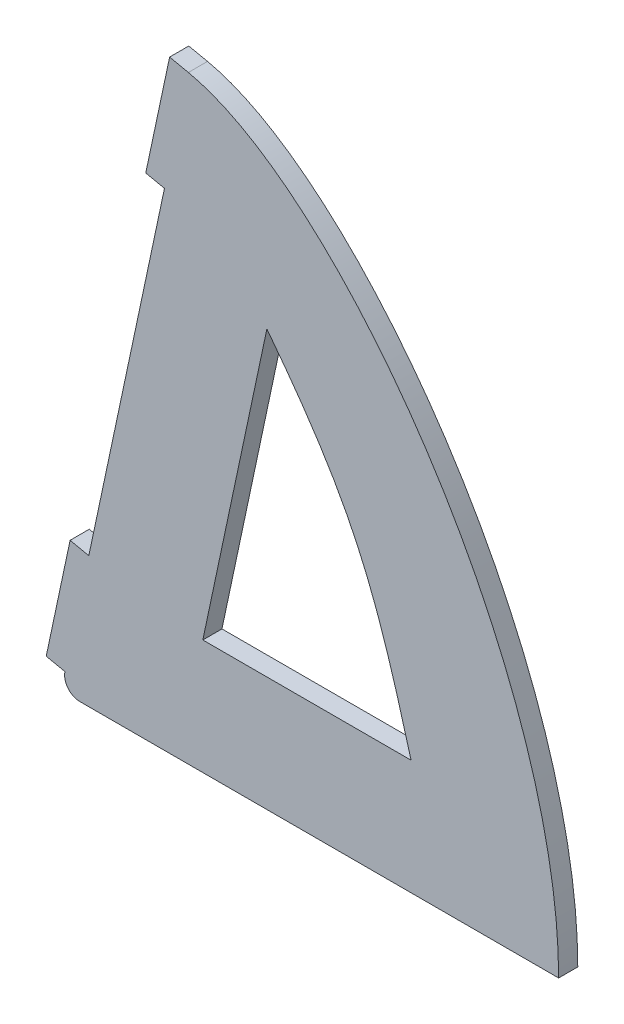
from build123d import *

# Parameters (mm, degrees)
BOSS_EXTRUDE1_DEPTH = 3.175


with BuildPart() as part:
    # Sketch1 → Boss-Extrude1 (new body)
    with BuildSketch(Plane.XY):
        with BuildLine():
            Line((17.163110077, 80.746084441), (4.612861582, 21.701807489))
            Line((4.612861582, 21.701807489), (1.507242949, 22.361927107))
            Line((1.507242949, 22.361927107), (-2.453474761, 3.728215313))
            Line((-2.453474761, 3.728215313), (0.652143872, 3.068095695))
            ThreePointArc((0.652143872, 3.068095695), (1.162688035, 0.941526207), (3.136638778, 0))
            Line((3.136638778, 0), (82.55, 0))
            add(Edge.make_bspline(
                [(21.123827787, 99.379796235), (46.706655255, 93.94199839), (82.55, 42.642349052), (82.55, 0)],
                knots=[0, 0, 0, 0, 1, 1, 1, 1], degree=3))
            Line((21.123827787, 99.379796235), (18.018209155, 100.039915853))
            Line((18.018209155, 100.039915853), (14.057491445, 81.406204059))
            Line((14.057491445, 81.406204059), (17.163110077, 80.746084441))
        make_face()
        with BuildLine():
            Line((34.151161557, 69.043143666), (23.524790832, 19.05))
            Line((23.524790832, 19.05), (58.0732756, 19.05))
            add(Edge.make_bspline(
                [(34.151161557, 69.043143666), (48.666575214, 50.286033003), (52.089459652, 40.771993911), (58.0732756, 19.05)],
                knots=[0, 0, 0, 0, 1, 1, 1, 1], degree=3))
        make_face(mode=Mode.SUBTRACT)
    extrude(amount=BOSS_EXTRUDE1_DEPTH)


solid = part.part
